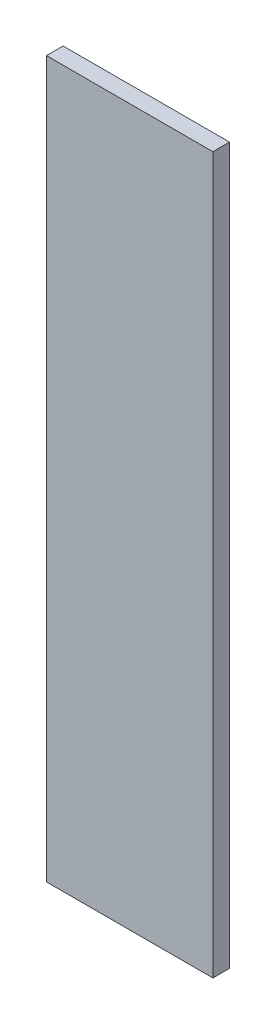
from build123d import *

# Parameters (mm, degrees)
SKETCH1_W           = 127
SKETCH1_H           = 546.1
BOSS_EXTRUDE1_DEPTH = 12.7


with BuildPart() as part:
    # Sketch1 → Boss-Extrude1 (new body)
    with BuildSketch(Plane.XY):
        with Locations((88.9, -50.8)):
            Rectangle(SKETCH1_W, SKETCH1_H)
    extrude(amount=BOSS_EXTRUDE1_DEPTH)


solid = part.part
